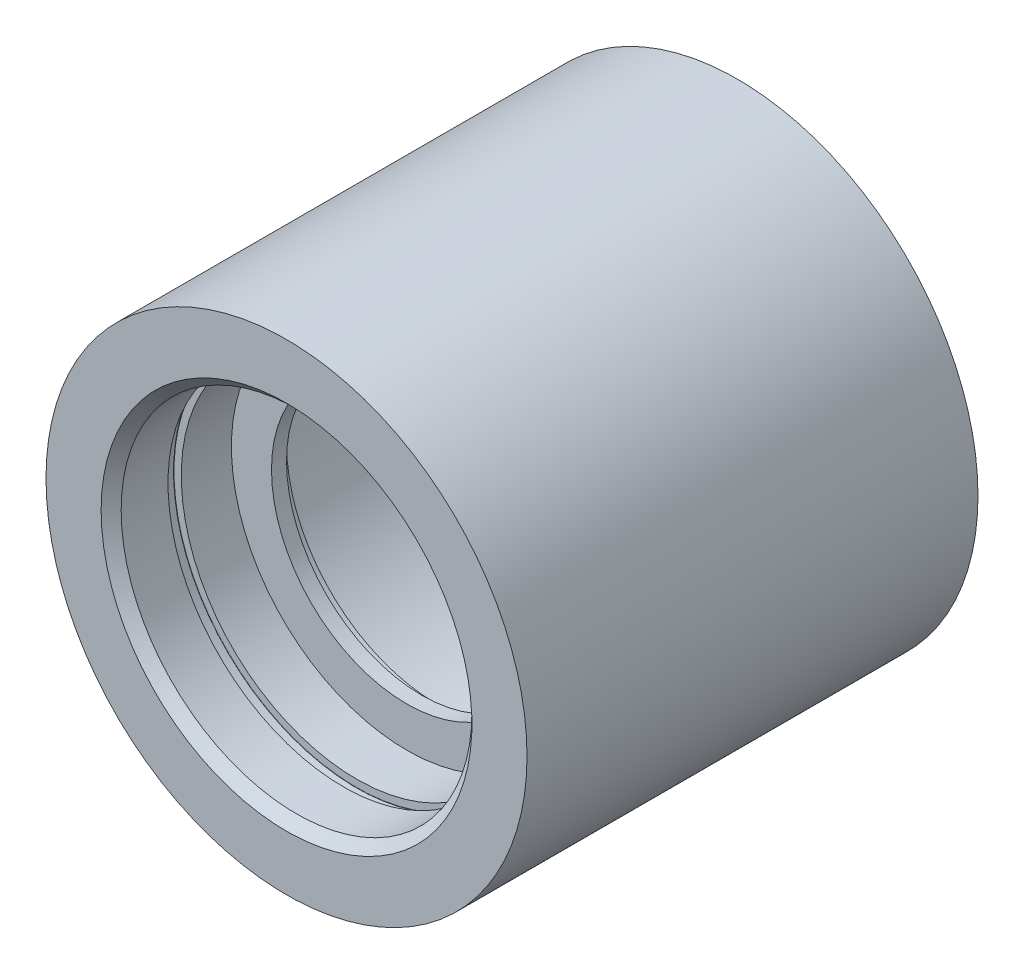
from build123d import *

# Parameters (mm, degrees)
SKETCH_2_R          = 36.5
CUT_EXTRUDE_1_DEPTH = 2.65
SKETCH_3_R          = 41.75
CUT_EXTRUDE_2_DEPTH = 2.65
FILLET_1_R          = 0.05
CHAMFER_2_SIZE      = 2


with BuildPart() as part:
    # Эскиз1 → Повернуть1 (revolve)
    with BuildSketch(Plane(origin=(0, 0, 0), x_dir=(0, 0, -1), z_dir=(1, 0, 0))):
        Polygon((0, 48), (90, 48), (90, 40), (30, 40), (30, 30), (27, 30), (27, 27), (24, 27), (24, 35), (0, 35), align=None)
    revolve(axis=Axis((0, 0, 0), (0, 0, -1)))

    # Эскиз2 → Вырез-Вытянуть1 (cut)
    with BuildSketch(Plane.XY.offset(-14)):
        Circle(SKETCH_2_R)
    extrude(amount=CUT_EXTRUDE_1_DEPTH, mode=Mode.SUBTRACT)

    # Эскиз3 → Вырез-Вытянуть2 (cut)
    with BuildSketch(Plane(origin=(0, 0, -69), x_dir=(-1, 0, 0), z_dir=(0, 0, -1))):
        Circle(SKETCH_3_R)
    extrude(amount=CUT_EXTRUDE_2_DEPTH, mode=Mode.SUBTRACT)

    # Скругление1
    fillet_1_edges = [part.edges().sort_by_distance(p)[0] for p in [
        (41.75, 0, -71.65),
        (41.75, 0, -69),
        (-36.5, 0, -11.35),
        (-36.5, 0, -14),
    ]]
    fillet(fillet_1_edges, radius=FILLET_1_R)

    # Фаска2
    chamfer_2_edges = [part.edges().sort_by_distance(p)[0] for p in [
        (0, -35, 0),
        (0, -40, -90),
    ]]
    chamfer(chamfer_2_edges, length=CHAMFER_2_SIZE)


solid = part.part
